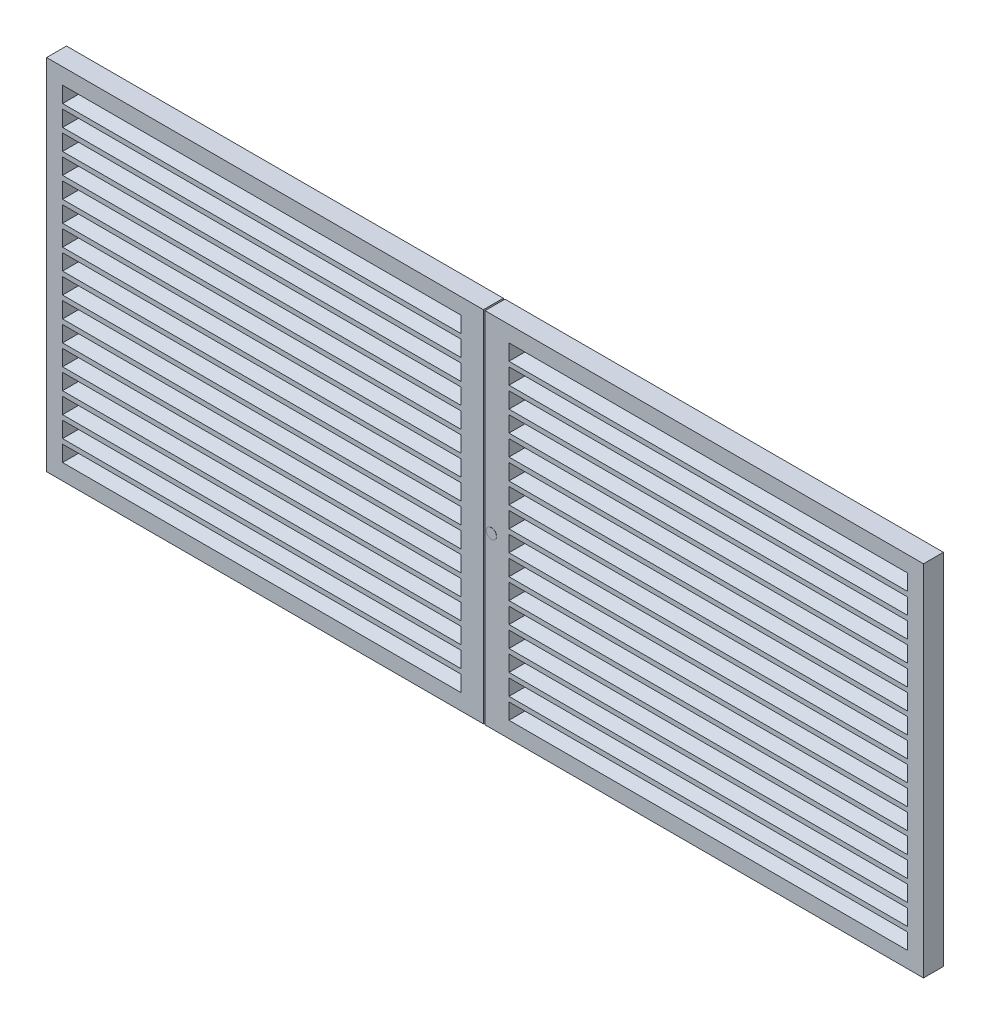
from build123d import *

# Parameters (mm, degrees)
CROQUIS1_W                      = 11000
CROQUIS1_H                      = 4500
SALIENTE_EXTRUIR1_DEPTH         = 250
CROQUIS2_W                      = 5000
CROQUIS2_H                      = 200
CORTAR_EXTRUIR1_DEPTH           = 250
CORTAR_EXTRUIR1_DRAFT           = -20
CORTAR_EXTRUIR1_PROFILE_2_DEPTH = 250
CORTAR_EXTRUIR1_PROFILE_2_DRAFT = -20
MATRIZL1_COPY_1_SKETCH_W        = 5000
MATRIZL1_COPY_1_SKETCH_H        = 200
MATRIZL1_COPY_1_DEPTH           = 250
MATRIZL1_COPY_1_DRAFT           = -20
MATRIZL1_COPY_2_SKETCH_W        = 5000
MATRIZL1_COPY_2_SKETCH_H        = 200
MATRIZL1_COPY_2_DEPTH           = 250
MATRIZL1_COPY_2_DRAFT           = -20
MATRIZL1_COPY_3_SKETCH_W        = 5000
MATRIZL1_COPY_3_SKETCH_H        = 200
MATRIZL1_COPY_3_DEPTH           = 250
MATRIZL1_COPY_3_DRAFT           = -20
MATRIZL1_COPY_4_SKETCH_W        = 5000
MATRIZL1_COPY_4_SKETCH_H        = 200
MATRIZL1_COPY_4_DEPTH           = 250
MATRIZL1_COPY_4_DRAFT           = -20
MATRIZL1_COPY_5_SKETCH_W        = 5000
MATRIZL1_COPY_5_SKETCH_H        = 200
MATRIZL1_COPY_5_DEPTH           = 250
MATRIZL1_COPY_5_DRAFT           = -20
MATRIZL1_COPY_6_SKETCH_W        = 5000
MATRIZL1_COPY_6_SKETCH_H        = 200
MATRIZL1_COPY_6_DEPTH           = 250
MATRIZL1_COPY_6_DRAFT           = -20
MATRIZL1_COPY_7_SKETCH_W        = 5000
MATRIZL1_COPY_7_SKETCH_H        = 200
MATRIZL1_COPY_7_DEPTH           = 250
MATRIZL1_COPY_7_DRAFT           = -20
MATRIZL1_COPY_8_SKETCH_W        = 5000
MATRIZL1_COPY_8_SKETCH_H        = 200
MATRIZL1_COPY_8_DEPTH           = 250
MATRIZL1_COPY_8_DRAFT           = -20
MATRIZL1_COPY_9_SKETCH_W        = 5000
MATRIZL1_COPY_9_SKETCH_H        = 200
MATRIZL1_COPY_9_DEPTH           = 250
MATRIZL1_COPY_9_DRAFT           = -20
MATRIZL1_COPY_10_SKETCH_W       = 5000
MATRIZL1_COPY_10_SKETCH_H       = 200
MATRIZL1_COPY_10_DEPTH          = 250
MATRIZL1_COPY_10_DRAFT          = -20
MATRIZL1_COPY_11_SKETCH_W       = 5000
MATRIZL1_COPY_11_SKETCH_H       = 200
MATRIZL1_COPY_11_DEPTH          = 250
MATRIZL1_COPY_11_DRAFT          = -20
MATRIZL1_COPY_12_SKETCH_W       = 5000
MATRIZL1_COPY_12_SKETCH_H       = 200
MATRIZL1_COPY_12_DEPTH          = 250
MATRIZL1_COPY_12_DRAFT          = -20
MATRIZL1_COPY_13_SKETCH_W       = 5000
MATRIZL1_COPY_13_SKETCH_H       = 200
MATRIZL1_COPY_13_DEPTH          = 250
MATRIZL1_COPY_13_DRAFT          = -20
MATRIZL1_COPY_14_SKETCH_W       = 5000
MATRIZL1_COPY_14_SKETCH_H       = 200
MATRIZL1_COPY_14_DEPTH          = 250
MATRIZL1_COPY_14_DRAFT          = -20
MATRIZL1_COPY_15_SKETCH_W       = 5000
MATRIZL1_COPY_15_SKETCH_H       = 200
MATRIZL1_COPY_15_DEPTH          = 250
MATRIZL1_COPY_15_DRAFT          = -20
MATRIZL1_COPY_16_SKETCH_W       = 5000
MATRIZL1_COPY_16_SKETCH_H       = 200
MATRIZL1_COPY_16_DEPTH          = 250
MATRIZL1_COPY_16_DRAFT          = -20
MATRIZL1_COPY_17_SKETCH_W       = 5000
MATRIZL1_COPY_17_SKETCH_H       = 200
MATRIZL1_COPY_17_DEPTH          = 250
MATRIZL1_COPY_17_DRAFT          = -20
MATRIZL1_COPY_18_SKETCH_W       = 5000
MATRIZL1_COPY_18_SKETCH_H       = 200
MATRIZL1_COPY_18_DEPTH          = 250
MATRIZL1_COPY_18_DRAFT          = -20
MATRIZL1_COPY_19_SKETCH_W       = 5000
MATRIZL1_COPY_19_SKETCH_H       = 200
MATRIZL1_COPY_19_DEPTH          = 250
MATRIZL1_COPY_19_DRAFT          = -20
MATRIZL1_COPY_20_SKETCH_W       = 5000
MATRIZL1_COPY_20_SKETCH_H       = 200
MATRIZL1_COPY_20_DEPTH          = 250
MATRIZL1_COPY_20_DRAFT          = -20
MATRIZL1_COPY_21_SKETCH_W       = 5000
MATRIZL1_COPY_21_SKETCH_H       = 200
MATRIZL1_COPY_21_DEPTH          = 250
MATRIZL1_COPY_21_DRAFT          = -20
MATRIZL1_COPY_22_SKETCH_W       = 5000
MATRIZL1_COPY_22_SKETCH_H       = 200
MATRIZL1_COPY_22_DEPTH          = 250
MATRIZL1_COPY_22_DRAFT          = -20
MATRIZL1_COPY_23_SKETCH_W       = 5000
MATRIZL1_COPY_23_SKETCH_H       = 200
MATRIZL1_COPY_23_DEPTH          = 250
MATRIZL1_COPY_23_DRAFT          = -20
MATRIZL1_COPY_24_SKETCH_W       = 5000
MATRIZL1_COPY_24_SKETCH_H       = 200
MATRIZL1_COPY_24_DEPTH          = 250
MATRIZL1_COPY_24_DRAFT          = -20
MATRIZL1_COPY_25_SKETCH_W       = 5000
MATRIZL1_COPY_25_SKETCH_H       = 200
MATRIZL1_COPY_25_DEPTH          = 250
MATRIZL1_COPY_25_DRAFT          = -20
MATRIZL1_COPY_26_SKETCH_W       = 5000
MATRIZL1_COPY_26_SKETCH_H       = 200
MATRIZL1_COPY_26_DEPTH          = 250
MATRIZL1_COPY_26_DRAFT          = -20
MATRIZL1_COPY_27_SKETCH_W       = 5000
MATRIZL1_COPY_27_SKETCH_H       = 200
MATRIZL1_COPY_27_DEPTH          = 250
MATRIZL1_COPY_27_DRAFT          = -20
MATRIZL1_COPY_28_SKETCH_W       = 5000
MATRIZL1_COPY_28_SKETCH_H       = 200
MATRIZL1_COPY_28_DEPTH          = 250
MATRIZL1_COPY_28_DRAFT          = -20
MATRIZL1_COPY_29_SKETCH_W       = 5000
MATRIZL1_COPY_29_SKETCH_H       = 200
MATRIZL1_COPY_29_DEPTH          = 250
MATRIZL1_COPY_29_DRAFT          = -20
MATRIZL1_COPY_30_SKETCH_W       = 5000
MATRIZL1_COPY_30_SKETCH_H       = 200
MATRIZL1_COPY_30_DEPTH          = 250
MATRIZL1_COPY_30_DRAFT          = -20
MATRIZL1_COPY_31_SKETCH_W       = 5000
MATRIZL1_COPY_31_SKETCH_H       = 200
MATRIZL1_COPY_31_DEPTH          = 250
MATRIZL1_COPY_31_DRAFT          = -20
MATRIZL1_COPY_32_SKETCH_W       = 5000
MATRIZL1_COPY_32_SKETCH_H       = 200
MATRIZL1_COPY_32_DEPTH          = 250
MATRIZL1_COPY_32_DRAFT          = -20
MATRIZL1_COPY_33_SKETCH_W       = 5000
MATRIZL1_COPY_33_SKETCH_H       = 200
MATRIZL1_COPY_33_DEPTH          = 250
MATRIZL1_COPY_33_DRAFT          = -20
MATRIZL1_COPY_34_SKETCH_W       = 5000
MATRIZL1_COPY_34_SKETCH_H       = 200
MATRIZL1_COPY_34_DEPTH          = 250
MATRIZL1_COPY_34_DRAFT          = -20
MATRIZL1_COPY_35_SKETCH_W       = 5000
MATRIZL1_COPY_35_SKETCH_H       = 200
MATRIZL1_COPY_35_DEPTH          = 250
MATRIZL1_COPY_35_DRAFT          = -20
MATRIZL1_COPY_36_SKETCH_W       = 5000
MATRIZL1_COPY_36_SKETCH_H       = 200
MATRIZL1_COPY_36_DEPTH          = 250
MATRIZL1_COPY_36_DRAFT          = -20
MATRIZL1_COPY_37_SKETCH_W       = 5000
MATRIZL1_COPY_37_SKETCH_H       = 200
MATRIZL1_COPY_37_DEPTH          = 250
MATRIZL1_COPY_37_DRAFT          = -20
MATRIZL1_COPY_38_SKETCH_W       = 5000
MATRIZL1_COPY_38_SKETCH_H       = 200
MATRIZL1_COPY_38_DEPTH          = 250
MATRIZL1_COPY_38_DRAFT          = -20
MATRIZL1_COPY_39_SKETCH_W       = 5000
MATRIZL1_COPY_39_SKETCH_H       = 200
MATRIZL1_COPY_39_DEPTH          = 250
MATRIZL1_COPY_39_DRAFT          = -20
MATRIZL1_COPY_40_SKETCH_W       = 5000
MATRIZL1_COPY_40_SKETCH_H       = 200
MATRIZL1_COPY_40_DEPTH          = 250
MATRIZL1_COPY_40_DRAFT          = -20
MATRIZL1_COPY_41_SKETCH_W       = 5000
MATRIZL1_COPY_41_SKETCH_H       = 200
MATRIZL1_COPY_41_DEPTH          = 250
MATRIZL1_COPY_41_DRAFT          = -20
MATRIZL1_COPY_42_SKETCH_W       = 5000
MATRIZL1_COPY_42_SKETCH_H       = 200
MATRIZL1_COPY_42_DEPTH          = 250
MATRIZL1_COPY_42_DRAFT          = -20
MATRIZL1_COPY_43_SKETCH_W       = 5000
MATRIZL1_COPY_43_SKETCH_H       = 200
MATRIZL1_COPY_43_DEPTH          = 250
MATRIZL1_COPY_43_DRAFT          = -20
MATRIZL1_COPY_44_SKETCH_W       = 5000
MATRIZL1_COPY_44_SKETCH_H       = 200
MATRIZL1_COPY_44_DEPTH          = 250
MATRIZL1_COPY_44_DRAFT          = -20
MATRIZL1_COPY_45_SKETCH_W       = 5000
MATRIZL1_COPY_45_SKETCH_H       = 200
MATRIZL1_COPY_45_DEPTH          = 250
MATRIZL1_COPY_45_DRAFT          = -20
CROQUIS3_R                      = 64.149560556
SALIENTE_EXTRUIR2_DEPTH         = 2
CROQUIS4_W                      = 20.5083018
CROQUIS4_H                      = 4500
CORTAR_EXTRUIR2_DEPTH           = 250


with BuildPart() as part:
    # Croquis1 → Saliente-Extruir1 (new body)
    with BuildSketch(Plane.XY):
        with Locations((5500, 2250)):
            Rectangle(CROQUIS1_W, CROQUIS1_H)
    extrude(amount=SALIENTE_EXTRUIR1_DEPTH)


with BuildPart() as cortar_extruir1_tool:
    # Croquis2 → Cortar-Extruir1 (with draft: the straight prism first)
    with BuildSketch(Plane.XY.offset(250)):
        with Locations((2700, 4200)):
            Rectangle(CROQUIS2_W, CROQUIS2_H)
    extrude(amount=-CORTAR_EXTRUIR1_DEPTH)
    # Cortar-Extruir1: the draft: its side faces are tilted about the plane it starts from
    cortar_extruir1_sides = [cortar_extruir1_tool.faces().sort_by_distance(p)[0] for p in [
        (200, 4200, 125),
        (2700, 4100, 125),
        (5200, 4200, 125),
        (2700, 4300, 125),
    ]]
    draft(cortar_extruir1_sides, Plane.XY.offset(250), CORTAR_EXTRUIR1_DRAFT)


with BuildPart() as part_1:
    add(part.part)

    # Cortar-Extruir1: cut by cortar_extruir1_tool
    add(cortar_extruir1_tool.part, mode=Mode.SUBTRACT)


with BuildPart() as cortar_extruir1_profile_2_tool:
    # Croquis2 → Cortar-Extruir1 profile 2 (with draft: the straight prism first)
    with BuildSketch(Plane.XY.offset(250)):
        with Locations((8300, 4200)):
            Rectangle(CROQUIS2_W, CROQUIS2_H)
    extrude(amount=-CORTAR_EXTRUIR1_PROFILE_2_DEPTH)
    # Cortar-Extruir1 profile 2: the draft: its side faces are tilted about the plane it starts from
    cortar_extruir1_profile_2_sides = [cortar_extruir1_profile_2_tool.faces().sort_by_distance(p)[0] for p in [
        (8300, 4300, 125),
        (5800, 4200, 125),
        (8300, 4100, 125),
        (10800, 4200, 125),
    ]]
    draft(cortar_extruir1_profile_2_sides, Plane.XY.offset(250), CORTAR_EXTRUIR1_PROFILE_2_DRAFT)


with BuildPart() as part_2:
    add(part_1.part)

    # Cortar-Extruir1 profile 2: cut by cortar_extruir1_profile_2_tool
    add(cortar_extruir1_profile_2_tool.part, mode=Mode.SUBTRACT)


with BuildPart() as matrizl1_copy_1_tool:
    # MatrizL1 copy 1 sketch → MatrizL1 copy 1 (with draft: the straight prism first)
    with BuildSketch(Plane(origin=(0, -260, 250), x_dir=(1, 0, 0), z_dir=(0, 0, 1))):
        with Locations((2700, 4200)):
            Rectangle(MATRIZL1_COPY_1_SKETCH_W, MATRIZL1_COPY_1_SKETCH_H)
    extrude(amount=-MATRIZL1_COPY_1_DEPTH)
    # MatrizL1 copy 1: the draft: its side faces are tilted about the plane it starts from
    matrizl1_copy_1_sides = [matrizl1_copy_1_tool.faces().sort_by_distance(p)[0] for p in [
        (200, 3940, 125),
        (2700, 3840, 125),
        (5200, 3940, 125),
        (2700, 4040, 125),
    ]]
    draft(matrizl1_copy_1_sides, Plane(origin=(0, -260, 250), x_dir=(1, 0, 0), z_dir=(0, 0, 1)), MATRIZL1_COPY_1_DRAFT)


with BuildPart() as part_3:
    add(part_2.part)

    # MatrizL1 copy 1: cut by matrizl1_copy_1_tool
    add(matrizl1_copy_1_tool.part, mode=Mode.SUBTRACT)


with BuildPart() as matrizl1_copy_2_tool:
    # MatrizL1 copy 2 sketch → MatrizL1 copy 2 (with draft: the straight prism first)
    with BuildSketch(Plane(origin=(0, -520, 250), x_dir=(1, 0, 0), z_dir=(0, 0, 1))):
        with Locations((2700, 4200)):
            Rectangle(MATRIZL1_COPY_2_SKETCH_W, MATRIZL1_COPY_2_SKETCH_H)
    extrude(amount=-MATRIZL1_COPY_2_DEPTH)
    # MatrizL1 copy 2: the draft: its side faces are tilted about the plane it starts from
    matrizl1_copy_2_sides = [matrizl1_copy_2_tool.faces().sort_by_distance(p)[0] for p in [
        (200, 3680, 125),
        (2700, 3580, 125),
        (5200, 3680, 125),
        (2700, 3780, 125),
    ]]
    draft(matrizl1_copy_2_sides, Plane(origin=(0, -520, 250), x_dir=(1, 0, 0), z_dir=(0, 0, 1)), MATRIZL1_COPY_2_DRAFT)


with BuildPart() as part_4:
    add(part_3.part)

    # MatrizL1 copy 2: cut by matrizl1_copy_2_tool
    add(matrizl1_copy_2_tool.part, mode=Mode.SUBTRACT)


with BuildPart() as matrizl1_copy_3_tool:
    # MatrizL1 copy 3 sketch → MatrizL1 copy 3 (with draft: the straight prism first)
    with BuildSketch(Plane(origin=(0, -780, 250), x_dir=(1, 0, 0), z_dir=(0, 0, 1))):
        with Locations((2700, 4200)):
            Rectangle(MATRIZL1_COPY_3_SKETCH_W, MATRIZL1_COPY_3_SKETCH_H)
    extrude(amount=-MATRIZL1_COPY_3_DEPTH)
    # MatrizL1 copy 3: the draft: its side faces are tilted about the plane it starts from
    matrizl1_copy_3_sides = [matrizl1_copy_3_tool.faces().sort_by_distance(p)[0] for p in [
        (200, 3420, 125),
        (2700, 3320, 125),
        (5200, 3420, 125),
        (2700, 3520, 125),
    ]]
    draft(matrizl1_copy_3_sides, Plane(origin=(0, -780, 250), x_dir=(1, 0, 0), z_dir=(0, 0, 1)), MATRIZL1_COPY_3_DRAFT)


with BuildPart() as part_5:
    add(part_4.part)

    # MatrizL1 copy 3: cut by matrizl1_copy_3_tool
    add(matrizl1_copy_3_tool.part, mode=Mode.SUBTRACT)


with BuildPart() as matrizl1_copy_4_tool:
    # MatrizL1 copy 4 sketch → MatrizL1 copy 4 (with draft: the straight prism first)
    with BuildSketch(Plane(origin=(0, -1040, 250), x_dir=(1, 0, 0), z_dir=(0, 0, 1))):
        with Locations((2700, 4200)):
            Rectangle(MATRIZL1_COPY_4_SKETCH_W, MATRIZL1_COPY_4_SKETCH_H)
    extrude(amount=-MATRIZL1_COPY_4_DEPTH)
    # MatrizL1 copy 4: the draft: its side faces are tilted about the plane it starts from
    matrizl1_copy_4_sides = [matrizl1_copy_4_tool.faces().sort_by_distance(p)[0] for p in [
        (200, 3160, 125),
        (2700, 3060, 125),
        (5200, 3160, 125),
        (2700, 3260, 125),
    ]]
    draft(matrizl1_copy_4_sides, Plane(origin=(0, -1040, 250), x_dir=(1, 0, 0), z_dir=(0, 0, 1)), MATRIZL1_COPY_4_DRAFT)


with BuildPart() as part_6:
    add(part_5.part)

    # MatrizL1 copy 4: cut by matrizl1_copy_4_tool
    add(matrizl1_copy_4_tool.part, mode=Mode.SUBTRACT)


with BuildPart() as matrizl1_copy_5_tool:
    # MatrizL1 copy 5 sketch → MatrizL1 copy 5 (with draft: the straight prism first)
    with BuildSketch(Plane(origin=(0, -1300, 250), x_dir=(1, 0, 0), z_dir=(0, 0, 1))):
        with Locations((2700, 4200)):
            Rectangle(MATRIZL1_COPY_5_SKETCH_W, MATRIZL1_COPY_5_SKETCH_H)
    extrude(amount=-MATRIZL1_COPY_5_DEPTH)
    # MatrizL1 copy 5: the draft: its side faces are tilted about the plane it starts from
    matrizl1_copy_5_sides = [matrizl1_copy_5_tool.faces().sort_by_distance(p)[0] for p in [
        (200, 2900, 125),
        (2700, 2800, 125),
        (5200, 2900, 125),
        (2700, 3000, 125),
    ]]
    draft(matrizl1_copy_5_sides, Plane(origin=(0, -1300, 250), x_dir=(1, 0, 0), z_dir=(0, 0, 1)), MATRIZL1_COPY_5_DRAFT)


with BuildPart() as part_7:
    add(part_6.part)

    # MatrizL1 copy 5: cut by matrizl1_copy_5_tool
    add(matrizl1_copy_5_tool.part, mode=Mode.SUBTRACT)


with BuildPart() as matrizl1_copy_6_tool:
    # MatrizL1 copy 6 sketch → MatrizL1 copy 6 (with draft: the straight prism first)
    with BuildSketch(Plane(origin=(0, -1560, 250), x_dir=(1, 0, 0), z_dir=(0, 0, 1))):
        with Locations((2700, 4200)):
            Rectangle(MATRIZL1_COPY_6_SKETCH_W, MATRIZL1_COPY_6_SKETCH_H)
    extrude(amount=-MATRIZL1_COPY_6_DEPTH)
    # MatrizL1 copy 6: the draft: its side faces are tilted about the plane it starts from
    matrizl1_copy_6_sides = [matrizl1_copy_6_tool.faces().sort_by_distance(p)[0] for p in [
        (200, 2640, 125),
        (2700, 2540, 125),
        (5200, 2640, 125),
        (2700, 2740, 125),
    ]]
    draft(matrizl1_copy_6_sides, Plane(origin=(0, -1560, 250), x_dir=(1, 0, 0), z_dir=(0, 0, 1)), MATRIZL1_COPY_6_DRAFT)


with BuildPart() as part_8:
    add(part_7.part)

    # MatrizL1 copy 6: cut by matrizl1_copy_6_tool
    add(matrizl1_copy_6_tool.part, mode=Mode.SUBTRACT)


with BuildPart() as matrizl1_copy_7_tool:
    # MatrizL1 copy 7 sketch → MatrizL1 copy 7 (with draft: the straight prism first)
    with BuildSketch(Plane(origin=(0, -1820, 250), x_dir=(1, 0, 0), z_dir=(0, 0, 1))):
        with Locations((2700, 4200)):
            Rectangle(MATRIZL1_COPY_7_SKETCH_W, MATRIZL1_COPY_7_SKETCH_H)
    extrude(amount=-MATRIZL1_COPY_7_DEPTH)
    # MatrizL1 copy 7: the draft: its side faces are tilted about the plane it starts from
    matrizl1_copy_7_sides = [matrizl1_copy_7_tool.faces().sort_by_distance(p)[0] for p in [
        (200, 2380, 125),
        (2700, 2280, 125),
        (5200, 2380, 125),
        (2700, 2480, 125),
    ]]
    draft(matrizl1_copy_7_sides, Plane(origin=(0, -1820, 250), x_dir=(1, 0, 0), z_dir=(0, 0, 1)), MATRIZL1_COPY_7_DRAFT)


with BuildPart() as part_9:
    add(part_8.part)

    # MatrizL1 copy 7: cut by matrizl1_copy_7_tool
    add(matrizl1_copy_7_tool.part, mode=Mode.SUBTRACT)


with BuildPart() as matrizl1_copy_8_tool:
    # MatrizL1 copy 8 sketch → MatrizL1 copy 8 (with draft: the straight prism first)
    with BuildSketch(Plane(origin=(0, -2080, 250), x_dir=(1, 0, 0), z_dir=(0, 0, 1))):
        with Locations((2700, 4200)):
            Rectangle(MATRIZL1_COPY_8_SKETCH_W, MATRIZL1_COPY_8_SKETCH_H)
    extrude(amount=-MATRIZL1_COPY_8_DEPTH)
    # MatrizL1 copy 8: the draft: its side faces are tilted about the plane it starts from
    matrizl1_copy_8_sides = [matrizl1_copy_8_tool.faces().sort_by_distance(p)[0] for p in [
        (200, 2120, 125),
        (2700, 2020, 125),
        (5200, 2120, 125),
        (2700, 2220, 125),
    ]]
    draft(matrizl1_copy_8_sides, Plane(origin=(0, -2080, 250), x_dir=(1, 0, 0), z_dir=(0, 0, 1)), MATRIZL1_COPY_8_DRAFT)


with BuildPart() as part_10:
    add(part_9.part)

    # MatrizL1 copy 8: cut by matrizl1_copy_8_tool
    add(matrizl1_copy_8_tool.part, mode=Mode.SUBTRACT)


with BuildPart() as matrizl1_copy_9_tool:
    # MatrizL1 copy 9 sketch → MatrizL1 copy 9 (with draft: the straight prism first)
    with BuildSketch(Plane(origin=(0, -2340, 250), x_dir=(1, 0, 0), z_dir=(0, 0, 1))):
        with Locations((2700, 4200)):
            Rectangle(MATRIZL1_COPY_9_SKETCH_W, MATRIZL1_COPY_9_SKETCH_H)
    extrude(amount=-MATRIZL1_COPY_9_DEPTH)
    # MatrizL1 copy 9: the draft: its side faces are tilted about the plane it starts from
    matrizl1_copy_9_sides = [matrizl1_copy_9_tool.faces().sort_by_distance(p)[0] for p in [
        (200, 1860, 125),
        (2700, 1760, 125),
        (5200, 1860, 125),
        (2700, 1960, 125),
    ]]
    draft(matrizl1_copy_9_sides, Plane(origin=(0, -2340, 250), x_dir=(1, 0, 0), z_dir=(0, 0, 1)), MATRIZL1_COPY_9_DRAFT)


with BuildPart() as part_11:
    add(part_10.part)

    # MatrizL1 copy 9: cut by matrizl1_copy_9_tool
    add(matrizl1_copy_9_tool.part, mode=Mode.SUBTRACT)


with BuildPart() as matrizl1_copy_10_tool:
    # MatrizL1 copy 10 sketch → MatrizL1 copy 10 (with draft: the straight prism first)
    with BuildSketch(Plane(origin=(0, -2600, 250), x_dir=(1, 0, 0), z_dir=(0, 0, 1))):
        with Locations((2700, 4200)):
            Rectangle(MATRIZL1_COPY_10_SKETCH_W, MATRIZL1_COPY_10_SKETCH_H)
    extrude(amount=-MATRIZL1_COPY_10_DEPTH)
    # MatrizL1 copy 10: the draft: its side faces are tilted about the plane it starts from
    matrizl1_copy_10_sides = [matrizl1_copy_10_tool.faces().sort_by_distance(p)[0] for p in [
        (200, 1600, 125),
        (2700, 1500, 125),
        (5200, 1600, 125),
        (2700, 1700, 125),
    ]]
    draft(matrizl1_copy_10_sides, Plane(origin=(0, -2600, 250), x_dir=(1, 0, 0), z_dir=(0, 0, 1)), MATRIZL1_COPY_10_DRAFT)


with BuildPart() as part_12:
    add(part_11.part)

    # MatrizL1 copy 10: cut by matrizl1_copy_10_tool
    add(matrizl1_copy_10_tool.part, mode=Mode.SUBTRACT)


with BuildPart() as matrizl1_copy_11_tool:
    # MatrizL1 copy 11 sketch → MatrizL1 copy 11 (with draft: the straight prism first)
    with BuildSketch(Plane(origin=(0, -2860, 250), x_dir=(1, 0, 0), z_dir=(0, 0, 1))):
        with Locations((2700, 4200)):
            Rectangle(MATRIZL1_COPY_11_SKETCH_W, MATRIZL1_COPY_11_SKETCH_H)
    extrude(amount=-MATRIZL1_COPY_11_DEPTH)
    # MatrizL1 copy 11: the draft: its side faces are tilted about the plane it starts from
    matrizl1_copy_11_sides = [matrizl1_copy_11_tool.faces().sort_by_distance(p)[0] for p in [
        (200, 1340, 125),
        (2700, 1240, 125),
        (5200, 1340, 125),
        (2700, 1440, 125),
    ]]
    draft(matrizl1_copy_11_sides, Plane(origin=(0, -2860, 250), x_dir=(1, 0, 0), z_dir=(0, 0, 1)), MATRIZL1_COPY_11_DRAFT)


with BuildPart() as part_13:
    add(part_12.part)

    # MatrizL1 copy 11: cut by matrizl1_copy_11_tool
    add(matrizl1_copy_11_tool.part, mode=Mode.SUBTRACT)


with BuildPart() as matrizl1_copy_12_tool:
    # MatrizL1 copy 12 sketch → MatrizL1 copy 12 (with draft: the straight prism first)
    with BuildSketch(Plane(origin=(0, -3120, 250), x_dir=(1, 0, 0), z_dir=(0, 0, 1))):
        with Locations((2700, 4200)):
            Rectangle(MATRIZL1_COPY_12_SKETCH_W, MATRIZL1_COPY_12_SKETCH_H)
    extrude(amount=-MATRIZL1_COPY_12_DEPTH)
    # MatrizL1 copy 12: the draft: its side faces are tilted about the plane it starts from
    matrizl1_copy_12_sides = [matrizl1_copy_12_tool.faces().sort_by_distance(p)[0] for p in [
        (200, 1080, 125),
        (2700, 980, 125),
        (5200, 1080, 125),
        (2700, 1180, 125),
    ]]
    draft(matrizl1_copy_12_sides, Plane(origin=(0, -3120, 250), x_dir=(1, 0, 0), z_dir=(0, 0, 1)), MATRIZL1_COPY_12_DRAFT)


with BuildPart() as part_14:
    add(part_13.part)

    # MatrizL1 copy 12: cut by matrizl1_copy_12_tool
    add(matrizl1_copy_12_tool.part, mode=Mode.SUBTRACT)


with BuildPart() as matrizl1_copy_13_tool:
    # MatrizL1 copy 13 sketch → MatrizL1 copy 13 (with draft: the straight prism first)
    with BuildSketch(Plane(origin=(0, -3380, 250), x_dir=(1, 0, 0), z_dir=(0, 0, 1))):
        with Locations((2700, 4200)):
            Rectangle(MATRIZL1_COPY_13_SKETCH_W, MATRIZL1_COPY_13_SKETCH_H)
    extrude(amount=-MATRIZL1_COPY_13_DEPTH)
    # MatrizL1 copy 13: the draft: its side faces are tilted about the plane it starts from
    matrizl1_copy_13_sides = [matrizl1_copy_13_tool.faces().sort_by_distance(p)[0] for p in [
        (200, 820, 125),
        (2700, 720, 125),
        (5200, 820, 125),
        (2700, 920, 125),
    ]]
    draft(matrizl1_copy_13_sides, Plane(origin=(0, -3380, 250), x_dir=(1, 0, 0), z_dir=(0, 0, 1)), MATRIZL1_COPY_13_DRAFT)


with BuildPart() as part_15:
    add(part_14.part)

    # MatrizL1 copy 13: cut by matrizl1_copy_13_tool
    add(matrizl1_copy_13_tool.part, mode=Mode.SUBTRACT)


with BuildPart() as matrizl1_copy_14_tool:
    # MatrizL1 copy 14 sketch → MatrizL1 copy 14 (with draft: the straight prism first)
    with BuildSketch(Plane(origin=(0, -3640, 250), x_dir=(1, 0, 0), z_dir=(0, 0, 1))):
        with Locations((2700, 4200)):
            Rectangle(MATRIZL1_COPY_14_SKETCH_W, MATRIZL1_COPY_14_SKETCH_H)
    extrude(amount=-MATRIZL1_COPY_14_DEPTH)
    # MatrizL1 copy 14: the draft: its side faces are tilted about the plane it starts from
    matrizl1_copy_14_sides = [matrizl1_copy_14_tool.faces().sort_by_distance(p)[0] for p in [
        (200, 560, 125),
        (2700, 460, 125),
        (5200, 560, 125),
        (2700, 660, 125),
    ]]
    draft(matrizl1_copy_14_sides, Plane(origin=(0, -3640, 250), x_dir=(1, 0, 0), z_dir=(0, 0, 1)), MATRIZL1_COPY_14_DRAFT)


with BuildPart() as part_16:
    add(part_15.part)

    # MatrizL1 copy 14: cut by matrizl1_copy_14_tool
    add(matrizl1_copy_14_tool.part, mode=Mode.SUBTRACT)


with BuildPart() as matrizl1_copy_15_tool:
    # MatrizL1 copy 15 sketch → MatrizL1 copy 15 (with draft: the straight prism first)
    with BuildSketch(Plane(origin=(0, -3900, 250), x_dir=(1, 0, 0), z_dir=(0, 0, 1))):
        with Locations((2700, 4200)):
            Rectangle(MATRIZL1_COPY_15_SKETCH_W, MATRIZL1_COPY_15_SKETCH_H)
    extrude(amount=-MATRIZL1_COPY_15_DEPTH)
    # MatrizL1 copy 15: the draft: its side faces are tilted about the plane it starts from
    matrizl1_copy_15_sides = [matrizl1_copy_15_tool.faces().sort_by_distance(p)[0] for p in [
        (200, 300, 125),
        (2700, 200, 125),
        (5200, 300, 125),
        (2700, 400, 125),
    ]]
    draft(matrizl1_copy_15_sides, Plane(origin=(0, -3900, 250), x_dir=(1, 0, 0), z_dir=(0, 0, 1)), MATRIZL1_COPY_15_DRAFT)


with BuildPart() as part_17:
    add(part_16.part)

    # MatrizL1 copy 15: cut by matrizl1_copy_15_tool
    add(matrizl1_copy_15_tool.part, mode=Mode.SUBTRACT)


with BuildPart() as matrizl1_copy_16_tool:
    # MatrizL1 copy 16 sketch → MatrizL1 copy 16 (with draft: the straight prism first)
    with BuildSketch(Plane(origin=(0, -260, 250), x_dir=(1, 0, 0), z_dir=(0, 0, 1))):
        with Locations((8300, 4200)):
            Rectangle(MATRIZL1_COPY_16_SKETCH_W, MATRIZL1_COPY_16_SKETCH_H)
    extrude(amount=-MATRIZL1_COPY_16_DEPTH)
    # MatrizL1 copy 16: the draft: its side faces are tilted about the plane it starts from
    matrizl1_copy_16_sides = [matrizl1_copy_16_tool.faces().sort_by_distance(p)[0] for p in [
        (8300, 4040, 125),
        (5800, 3940, 125),
        (8300, 3840, 125),
        (10800, 3940, 125),
    ]]
    draft(matrizl1_copy_16_sides, Plane(origin=(0, -260, 250), x_dir=(1, 0, 0), z_dir=(0, 0, 1)), MATRIZL1_COPY_16_DRAFT)


with BuildPart() as part_18:
    add(part_17.part)

    # MatrizL1 copy 16: cut by matrizl1_copy_16_tool
    add(matrizl1_copy_16_tool.part, mode=Mode.SUBTRACT)


with BuildPart() as matrizl1_copy_17_tool:
    # MatrizL1 copy 17 sketch → MatrizL1 copy 17 (with draft: the straight prism first)
    with BuildSketch(Plane(origin=(0, -520, 250), x_dir=(1, 0, 0), z_dir=(0, 0, 1))):
        with Locations((8300, 4200)):
            Rectangle(MATRIZL1_COPY_17_SKETCH_W, MATRIZL1_COPY_17_SKETCH_H)
    extrude(amount=-MATRIZL1_COPY_17_DEPTH)
    # MatrizL1 copy 17: the draft: its side faces are tilted about the plane it starts from
    matrizl1_copy_17_sides = [matrizl1_copy_17_tool.faces().sort_by_distance(p)[0] for p in [
        (8300, 3780, 125),
        (5800, 3680, 125),
        (8300, 3580, 125),
        (10800, 3680, 125),
    ]]
    draft(matrizl1_copy_17_sides, Plane(origin=(0, -520, 250), x_dir=(1, 0, 0), z_dir=(0, 0, 1)), MATRIZL1_COPY_17_DRAFT)


with BuildPart() as part_19:
    add(part_18.part)

    # MatrizL1 copy 17: cut by matrizl1_copy_17_tool
    add(matrizl1_copy_17_tool.part, mode=Mode.SUBTRACT)


with BuildPart() as matrizl1_copy_18_tool:
    # MatrizL1 copy 18 sketch → MatrizL1 copy 18 (with draft: the straight prism first)
    with BuildSketch(Plane(origin=(0, -780, 250), x_dir=(1, 0, 0), z_dir=(0, 0, 1))):
        with Locations((8300, 4200)):
            Rectangle(MATRIZL1_COPY_18_SKETCH_W, MATRIZL1_COPY_18_SKETCH_H)
    extrude(amount=-MATRIZL1_COPY_18_DEPTH)
    # MatrizL1 copy 18: the draft: its side faces are tilted about the plane it starts from
    matrizl1_copy_18_sides = [matrizl1_copy_18_tool.faces().sort_by_distance(p)[0] for p in [
        (8300, 3520, 125),
        (5800, 3420, 125),
        (8300, 3320, 125),
        (10800, 3420, 125),
    ]]
    draft(matrizl1_copy_18_sides, Plane(origin=(0, -780, 250), x_dir=(1, 0, 0), z_dir=(0, 0, 1)), MATRIZL1_COPY_18_DRAFT)


with BuildPart() as part_20:
    add(part_19.part)

    # MatrizL1 copy 18: cut by matrizl1_copy_18_tool
    add(matrizl1_copy_18_tool.part, mode=Mode.SUBTRACT)


with BuildPart() as matrizl1_copy_19_tool:
    # MatrizL1 copy 19 sketch → MatrizL1 copy 19 (with draft: the straight prism first)
    with BuildSketch(Plane(origin=(0, -1040, 250), x_dir=(1, 0, 0), z_dir=(0, 0, 1))):
        with Locations((8300, 4200)):
            Rectangle(MATRIZL1_COPY_19_SKETCH_W, MATRIZL1_COPY_19_SKETCH_H)
    extrude(amount=-MATRIZL1_COPY_19_DEPTH)
    # MatrizL1 copy 19: the draft: its side faces are tilted about the plane it starts from
    matrizl1_copy_19_sides = [matrizl1_copy_19_tool.faces().sort_by_distance(p)[0] for p in [
        (8300, 3260, 125),
        (5800, 3160, 125),
        (8300, 3060, 125),
        (10800, 3160, 125),
    ]]
    draft(matrizl1_copy_19_sides, Plane(origin=(0, -1040, 250), x_dir=(1, 0, 0), z_dir=(0, 0, 1)), MATRIZL1_COPY_19_DRAFT)


with BuildPart() as part_21:
    add(part_20.part)

    # MatrizL1 copy 19: cut by matrizl1_copy_19_tool
    add(matrizl1_copy_19_tool.part, mode=Mode.SUBTRACT)


with BuildPart() as matrizl1_copy_20_tool:
    # MatrizL1 copy 20 sketch → MatrizL1 copy 20 (with draft: the straight prism first)
    with BuildSketch(Plane(origin=(0, -1300, 250), x_dir=(1, 0, 0), z_dir=(0, 0, 1))):
        with Locations((8300, 4200)):
            Rectangle(MATRIZL1_COPY_20_SKETCH_W, MATRIZL1_COPY_20_SKETCH_H)
    extrude(amount=-MATRIZL1_COPY_20_DEPTH)
    # MatrizL1 copy 20: the draft: its side faces are tilted about the plane it starts from
    matrizl1_copy_20_sides = [matrizl1_copy_20_tool.faces().sort_by_distance(p)[0] for p in [
        (8300, 3000, 125),
        (5800, 2900, 125),
        (8300, 2800, 125),
        (10800, 2900, 125),
    ]]
    draft(matrizl1_copy_20_sides, Plane(origin=(0, -1300, 250), x_dir=(1, 0, 0), z_dir=(0, 0, 1)), MATRIZL1_COPY_20_DRAFT)


with BuildPart() as part_22:
    add(part_21.part)

    # MatrizL1 copy 20: cut by matrizl1_copy_20_tool
    add(matrizl1_copy_20_tool.part, mode=Mode.SUBTRACT)


with BuildPart() as matrizl1_copy_21_tool:
    # MatrizL1 copy 21 sketch → MatrizL1 copy 21 (with draft: the straight prism first)
    with BuildSketch(Plane(origin=(0, -1560, 250), x_dir=(1, 0, 0), z_dir=(0, 0, 1))):
        with Locations((8300, 4200)):
            Rectangle(MATRIZL1_COPY_21_SKETCH_W, MATRIZL1_COPY_21_SKETCH_H)
    extrude(amount=-MATRIZL1_COPY_21_DEPTH)
    # MatrizL1 copy 21: the draft: its side faces are tilted about the plane it starts from
    matrizl1_copy_21_sides = [matrizl1_copy_21_tool.faces().sort_by_distance(p)[0] for p in [
        (8300, 2740, 125),
        (5800, 2640, 125),
        (8300, 2540, 125),
        (10800, 2640, 125),
    ]]
    draft(matrizl1_copy_21_sides, Plane(origin=(0, -1560, 250), x_dir=(1, 0, 0), z_dir=(0, 0, 1)), MATRIZL1_COPY_21_DRAFT)


with BuildPart() as part_23:
    add(part_22.part)

    # MatrizL1 copy 21: cut by matrizl1_copy_21_tool
    add(matrizl1_copy_21_tool.part, mode=Mode.SUBTRACT)


with BuildPart() as matrizl1_copy_22_tool:
    # MatrizL1 copy 22 sketch → MatrizL1 copy 22 (with draft: the straight prism first)
    with BuildSketch(Plane(origin=(0, -1820, 250), x_dir=(1, 0, 0), z_dir=(0, 0, 1))):
        with Locations((8300, 4200)):
            Rectangle(MATRIZL1_COPY_22_SKETCH_W, MATRIZL1_COPY_22_SKETCH_H)
    extrude(amount=-MATRIZL1_COPY_22_DEPTH)
    # MatrizL1 copy 22: the draft: its side faces are tilted about the plane it starts from
    matrizl1_copy_22_sides = [matrizl1_copy_22_tool.faces().sort_by_distance(p)[0] for p in [
        (8300, 2480, 125),
        (5800, 2380, 125),
        (8300, 2280, 125),
        (10800, 2380, 125),
    ]]
    draft(matrizl1_copy_22_sides, Plane(origin=(0, -1820, 250), x_dir=(1, 0, 0), z_dir=(0, 0, 1)), MATRIZL1_COPY_22_DRAFT)


with BuildPart() as part_24:
    add(part_23.part)

    # MatrizL1 copy 22: cut by matrizl1_copy_22_tool
    add(matrizl1_copy_22_tool.part, mode=Mode.SUBTRACT)


with BuildPart() as matrizl1_copy_23_tool:
    # MatrizL1 copy 23 sketch → MatrizL1 copy 23 (with draft: the straight prism first)
    with BuildSketch(Plane(origin=(0, -2080, 250), x_dir=(1, 0, 0), z_dir=(0, 0, 1))):
        with Locations((8300, 4200)):
            Rectangle(MATRIZL1_COPY_23_SKETCH_W, MATRIZL1_COPY_23_SKETCH_H)
    extrude(amount=-MATRIZL1_COPY_23_DEPTH)
    # MatrizL1 copy 23: the draft: its side faces are tilted about the plane it starts from
    matrizl1_copy_23_sides = [matrizl1_copy_23_tool.faces().sort_by_distance(p)[0] for p in [
        (8300, 2220, 125),
        (5800, 2120, 125),
        (8300, 2020, 125),
        (10800, 2120, 125),
    ]]
    draft(matrizl1_copy_23_sides, Plane(origin=(0, -2080, 250), x_dir=(1, 0, 0), z_dir=(0, 0, 1)), MATRIZL1_COPY_23_DRAFT)


with BuildPart() as part_25:
    add(part_24.part)

    # MatrizL1 copy 23: cut by matrizl1_copy_23_tool
    add(matrizl1_copy_23_tool.part, mode=Mode.SUBTRACT)


with BuildPart() as matrizl1_copy_24_tool:
    # MatrizL1 copy 24 sketch → MatrizL1 copy 24 (with draft: the straight prism first)
    with BuildSketch(Plane(origin=(0, -2340, 250), x_dir=(1, 0, 0), z_dir=(0, 0, 1))):
        with Locations((8300, 4200)):
            Rectangle(MATRIZL1_COPY_24_SKETCH_W, MATRIZL1_COPY_24_SKETCH_H)
    extrude(amount=-MATRIZL1_COPY_24_DEPTH)
    # MatrizL1 copy 24: the draft: its side faces are tilted about the plane it starts from
    matrizl1_copy_24_sides = [matrizl1_copy_24_tool.faces().sort_by_distance(p)[0] for p in [
        (8300, 1960, 125),
        (5800, 1860, 125),
        (8300, 1760, 125),
        (10800, 1860, 125),
    ]]
    draft(matrizl1_copy_24_sides, Plane(origin=(0, -2340, 250), x_dir=(1, 0, 0), z_dir=(0, 0, 1)), MATRIZL1_COPY_24_DRAFT)


with BuildPart() as part_26:
    add(part_25.part)

    # MatrizL1 copy 24: cut by matrizl1_copy_24_tool
    add(matrizl1_copy_24_tool.part, mode=Mode.SUBTRACT)


with BuildPart() as matrizl1_copy_25_tool:
    # MatrizL1 copy 25 sketch → MatrizL1 copy 25 (with draft: the straight prism first)
    with BuildSketch(Plane(origin=(0, -2600, 250), x_dir=(1, 0, 0), z_dir=(0, 0, 1))):
        with Locations((8300, 4200)):
            Rectangle(MATRIZL1_COPY_25_SKETCH_W, MATRIZL1_COPY_25_SKETCH_H)
    extrude(amount=-MATRIZL1_COPY_25_DEPTH)
    # MatrizL1 copy 25: the draft: its side faces are tilted about the plane it starts from
    matrizl1_copy_25_sides = [matrizl1_copy_25_tool.faces().sort_by_distance(p)[0] for p in [
        (8300, 1700, 125),
        (5800, 1600, 125),
        (8300, 1500, 125),
        (10800, 1600, 125),
    ]]
    draft(matrizl1_copy_25_sides, Plane(origin=(0, -2600, 250), x_dir=(1, 0, 0), z_dir=(0, 0, 1)), MATRIZL1_COPY_25_DRAFT)


with BuildPart() as part_27:
    add(part_26.part)

    # MatrizL1 copy 25: cut by matrizl1_copy_25_tool
    add(matrizl1_copy_25_tool.part, mode=Mode.SUBTRACT)


with BuildPart() as matrizl1_copy_26_tool:
    # MatrizL1 copy 26 sketch → MatrizL1 copy 26 (with draft: the straight prism first)
    with BuildSketch(Plane(origin=(0, -2860, 250), x_dir=(1, 0, 0), z_dir=(0, 0, 1))):
        with Locations((8300, 4200)):
            Rectangle(MATRIZL1_COPY_26_SKETCH_W, MATRIZL1_COPY_26_SKETCH_H)
    extrude(amount=-MATRIZL1_COPY_26_DEPTH)
    # MatrizL1 copy 26: the draft: its side faces are tilted about the plane it starts from
    matrizl1_copy_26_sides = [matrizl1_copy_26_tool.faces().sort_by_distance(p)[0] for p in [
        (8300, 1440, 125),
        (5800, 1340, 125),
        (8300, 1240, 125),
        (10800, 1340, 125),
    ]]
    draft(matrizl1_copy_26_sides, Plane(origin=(0, -2860, 250), x_dir=(1, 0, 0), z_dir=(0, 0, 1)), MATRIZL1_COPY_26_DRAFT)


with BuildPart() as part_28:
    add(part_27.part)

    # MatrizL1 copy 26: cut by matrizl1_copy_26_tool
    add(matrizl1_copy_26_tool.part, mode=Mode.SUBTRACT)


with BuildPart() as matrizl1_copy_27_tool:
    # MatrizL1 copy 27 sketch → MatrizL1 copy 27 (with draft: the straight prism first)
    with BuildSketch(Plane(origin=(0, -3120, 250), x_dir=(1, 0, 0), z_dir=(0, 0, 1))):
        with Locations((8300, 4200)):
            Rectangle(MATRIZL1_COPY_27_SKETCH_W, MATRIZL1_COPY_27_SKETCH_H)
    extrude(amount=-MATRIZL1_COPY_27_DEPTH)
    # MatrizL1 copy 27: the draft: its side faces are tilted about the plane it starts from
    matrizl1_copy_27_sides = [matrizl1_copy_27_tool.faces().sort_by_distance(p)[0] for p in [
        (8300, 1180, 125),
        (5800, 1080, 125),
        (8300, 980, 125),
        (10800, 1080, 125),
    ]]
    draft(matrizl1_copy_27_sides, Plane(origin=(0, -3120, 250), x_dir=(1, 0, 0), z_dir=(0, 0, 1)), MATRIZL1_COPY_27_DRAFT)


with BuildPart() as part_29:
    add(part_28.part)

    # MatrizL1 copy 27: cut by matrizl1_copy_27_tool
    add(matrizl1_copy_27_tool.part, mode=Mode.SUBTRACT)


with BuildPart() as matrizl1_copy_28_tool:
    # MatrizL1 copy 28 sketch → MatrizL1 copy 28 (with draft: the straight prism first)
    with BuildSketch(Plane(origin=(0, -3380, 250), x_dir=(1, 0, 0), z_dir=(0, 0, 1))):
        with Locations((8300, 4200)):
            Rectangle(MATRIZL1_COPY_28_SKETCH_W, MATRIZL1_COPY_28_SKETCH_H)
    extrude(amount=-MATRIZL1_COPY_28_DEPTH)
    # MatrizL1 copy 28: the draft: its side faces are tilted about the plane it starts from
    matrizl1_copy_28_sides = [matrizl1_copy_28_tool.faces().sort_by_distance(p)[0] for p in [
        (8300, 920, 125),
        (5800, 820, 125),
        (8300, 720, 125),
        (10800, 820, 125),
    ]]
    draft(matrizl1_copy_28_sides, Plane(origin=(0, -3380, 250), x_dir=(1, 0, 0), z_dir=(0, 0, 1)), MATRIZL1_COPY_28_DRAFT)


with BuildPart() as part_30:
    add(part_29.part)

    # MatrizL1 copy 28: cut by matrizl1_copy_28_tool
    add(matrizl1_copy_28_tool.part, mode=Mode.SUBTRACT)


with BuildPart() as matrizl1_copy_29_tool:
    # MatrizL1 copy 29 sketch → MatrizL1 copy 29 (with draft: the straight prism first)
    with BuildSketch(Plane(origin=(0, -3640, 250), x_dir=(1, 0, 0), z_dir=(0, 0, 1))):
        with Locations((8300, 4200)):
            Rectangle(MATRIZL1_COPY_29_SKETCH_W, MATRIZL1_COPY_29_SKETCH_H)
    extrude(amount=-MATRIZL1_COPY_29_DEPTH)
    # MatrizL1 copy 29: the draft: its side faces are tilted about the plane it starts from
    matrizl1_copy_29_sides = [matrizl1_copy_29_tool.faces().sort_by_distance(p)[0] for p in [
        (8300, 660, 125),
        (5800, 560, 125),
        (8300, 460, 125),
        (10800, 560, 125),
    ]]
    draft(matrizl1_copy_29_sides, Plane(origin=(0, -3640, 250), x_dir=(1, 0, 0), z_dir=(0, 0, 1)), MATRIZL1_COPY_29_DRAFT)


with BuildPart() as part_31:
    add(part_30.part)

    # MatrizL1 copy 29: cut by matrizl1_copy_29_tool
    add(matrizl1_copy_29_tool.part, mode=Mode.SUBTRACT)


with BuildPart() as matrizl1_copy_30_tool:
    # MatrizL1 copy 30 sketch → MatrizL1 copy 30 (with draft: the straight prism first)
    with BuildSketch(Plane(origin=(0, -3900, 250), x_dir=(1, 0, 0), z_dir=(0, 0, 1))):
        with Locations((8300, 4200)):
            Rectangle(MATRIZL1_COPY_30_SKETCH_W, MATRIZL1_COPY_30_SKETCH_H)
    extrude(amount=-MATRIZL1_COPY_30_DEPTH)
    # MatrizL1 copy 30: the draft: its side faces are tilted about the plane it starts from
    matrizl1_copy_30_sides = [matrizl1_copy_30_tool.faces().sort_by_distance(p)[0] for p in [
        (8300, 400, 125),
        (5800, 300, 125),
        (8300, 200, 125),
        (10800, 300, 125),
    ]]
    draft(matrizl1_copy_30_sides, Plane(origin=(0, -3900, 250), x_dir=(1, 0, 0), z_dir=(0, 0, 1)), MATRIZL1_COPY_30_DRAFT)


with BuildPart() as part_32:
    add(part_31.part)

    # MatrizL1 copy 30: cut by matrizl1_copy_30_tool
    add(matrizl1_copy_30_tool.part, mode=Mode.SUBTRACT)


with BuildPart() as matrizl1_copy_31_tool:
    # MatrizL1 copy 31 sketch → MatrizL1 copy 31 (with draft: the straight prism first)
    with BuildSketch(Plane(origin=(0, -260, 250), x_dir=(1, 0, 0), z_dir=(0, 0, 1))):
        with Locations((8300, 4200)):
            Rectangle(MATRIZL1_COPY_31_SKETCH_W, MATRIZL1_COPY_31_SKETCH_H)
    extrude(amount=-MATRIZL1_COPY_31_DEPTH)
    # MatrizL1 copy 31: the draft: its side faces are tilted about the plane it starts from
    matrizl1_copy_31_sides = [matrizl1_copy_31_tool.faces().sort_by_distance(p)[0] for p in [
        (8300, 4040, 125),
        (5800, 3940, 125),
        (8300, 3840, 125),
        (10800, 3940, 125),
    ]]
    draft(matrizl1_copy_31_sides, Plane(origin=(0, -260, 250), x_dir=(1, 0, 0), z_dir=(0, 0, 1)), MATRIZL1_COPY_31_DRAFT)


with BuildPart() as part_33:
    add(part_32.part)

    # MatrizL1 copy 31: cut by matrizl1_copy_31_tool
    add(matrizl1_copy_31_tool.part, mode=Mode.SUBTRACT)


with BuildPart() as matrizl1_copy_32_tool:
    # MatrizL1 copy 32 sketch → MatrizL1 copy 32 (with draft: the straight prism first)
    with BuildSketch(Plane(origin=(0, -520, 250), x_dir=(1, 0, 0), z_dir=(0, 0, 1))):
        with Locations((8300, 4200)):
            Rectangle(MATRIZL1_COPY_32_SKETCH_W, MATRIZL1_COPY_32_SKETCH_H)
    extrude(amount=-MATRIZL1_COPY_32_DEPTH)
    # MatrizL1 copy 32: the draft: its side faces are tilted about the plane it starts from
    matrizl1_copy_32_sides = [matrizl1_copy_32_tool.faces().sort_by_distance(p)[0] for p in [
        (8300, 3780, 125),
        (5800, 3680, 125),
        (8300, 3580, 125),
        (10800, 3680, 125),
    ]]
    draft(matrizl1_copy_32_sides, Plane(origin=(0, -520, 250), x_dir=(1, 0, 0), z_dir=(0, 0, 1)), MATRIZL1_COPY_32_DRAFT)


with BuildPart() as part_34:
    add(part_33.part)

    # MatrizL1 copy 32: cut by matrizl1_copy_32_tool
    add(matrizl1_copy_32_tool.part, mode=Mode.SUBTRACT)


with BuildPart() as matrizl1_copy_33_tool:
    # MatrizL1 copy 33 sketch → MatrizL1 copy 33 (with draft: the straight prism first)
    with BuildSketch(Plane(origin=(0, -780, 250), x_dir=(1, 0, 0), z_dir=(0, 0, 1))):
        with Locations((8300, 4200)):
            Rectangle(MATRIZL1_COPY_33_SKETCH_W, MATRIZL1_COPY_33_SKETCH_H)
    extrude(amount=-MATRIZL1_COPY_33_DEPTH)
    # MatrizL1 copy 33: the draft: its side faces are tilted about the plane it starts from
    matrizl1_copy_33_sides = [matrizl1_copy_33_tool.faces().sort_by_distance(p)[0] for p in [
        (8300, 3520, 125),
        (5800, 3420, 125),
        (8300, 3320, 125),
        (10800, 3420, 125),
    ]]
    draft(matrizl1_copy_33_sides, Plane(origin=(0, -780, 250), x_dir=(1, 0, 0), z_dir=(0, 0, 1)), MATRIZL1_COPY_33_DRAFT)


with BuildPart() as part_35:
    add(part_34.part)

    # MatrizL1 copy 33: cut by matrizl1_copy_33_tool
    add(matrizl1_copy_33_tool.part, mode=Mode.SUBTRACT)


with BuildPart() as matrizl1_copy_34_tool:
    # MatrizL1 copy 34 sketch → MatrizL1 copy 34 (with draft: the straight prism first)
    with BuildSketch(Plane(origin=(0, -1040, 250), x_dir=(1, 0, 0), z_dir=(0, 0, 1))):
        with Locations((8300, 4200)):
            Rectangle(MATRIZL1_COPY_34_SKETCH_W, MATRIZL1_COPY_34_SKETCH_H)
    extrude(amount=-MATRIZL1_COPY_34_DEPTH)
    # MatrizL1 copy 34: the draft: its side faces are tilted about the plane it starts from
    matrizl1_copy_34_sides = [matrizl1_copy_34_tool.faces().sort_by_distance(p)[0] for p in [
        (8300, 3260, 125),
        (5800, 3160, 125),
        (8300, 3060, 125),
        (10800, 3160, 125),
    ]]
    draft(matrizl1_copy_34_sides, Plane(origin=(0, -1040, 250), x_dir=(1, 0, 0), z_dir=(0, 0, 1)), MATRIZL1_COPY_34_DRAFT)


with BuildPart() as part_36:
    add(part_35.part)

    # MatrizL1 copy 34: cut by matrizl1_copy_34_tool
    add(matrizl1_copy_34_tool.part, mode=Mode.SUBTRACT)


with BuildPart() as matrizl1_copy_35_tool:
    # MatrizL1 copy 35 sketch → MatrizL1 copy 35 (with draft: the straight prism first)
    with BuildSketch(Plane(origin=(0, -1300, 250), x_dir=(1, 0, 0), z_dir=(0, 0, 1))):
        with Locations((8300, 4200)):
            Rectangle(MATRIZL1_COPY_35_SKETCH_W, MATRIZL1_COPY_35_SKETCH_H)
    extrude(amount=-MATRIZL1_COPY_35_DEPTH)
    # MatrizL1 copy 35: the draft: its side faces are tilted about the plane it starts from
    matrizl1_copy_35_sides = [matrizl1_copy_35_tool.faces().sort_by_distance(p)[0] for p in [
        (8300, 3000, 125),
        (5800, 2900, 125),
        (8300, 2800, 125),
        (10800, 2900, 125),
    ]]
    draft(matrizl1_copy_35_sides, Plane(origin=(0, -1300, 250), x_dir=(1, 0, 0), z_dir=(0, 0, 1)), MATRIZL1_COPY_35_DRAFT)


with BuildPart() as part_37:
    add(part_36.part)

    # MatrizL1 copy 35: cut by matrizl1_copy_35_tool
    add(matrizl1_copy_35_tool.part, mode=Mode.SUBTRACT)


with BuildPart() as matrizl1_copy_36_tool:
    # MatrizL1 copy 36 sketch → MatrizL1 copy 36 (with draft: the straight prism first)
    with BuildSketch(Plane(origin=(0, -1560, 250), x_dir=(1, 0, 0), z_dir=(0, 0, 1))):
        with Locations((8300, 4200)):
            Rectangle(MATRIZL1_COPY_36_SKETCH_W, MATRIZL1_COPY_36_SKETCH_H)
    extrude(amount=-MATRIZL1_COPY_36_DEPTH)
    # MatrizL1 copy 36: the draft: its side faces are tilted about the plane it starts from
    matrizl1_copy_36_sides = [matrizl1_copy_36_tool.faces().sort_by_distance(p)[0] for p in [
        (8300, 2740, 125),
        (5800, 2640, 125),
        (8300, 2540, 125),
        (10800, 2640, 125),
    ]]
    draft(matrizl1_copy_36_sides, Plane(origin=(0, -1560, 250), x_dir=(1, 0, 0), z_dir=(0, 0, 1)), MATRIZL1_COPY_36_DRAFT)


with BuildPart() as part_38:
    add(part_37.part)

    # MatrizL1 copy 36: cut by matrizl1_copy_36_tool
    add(matrizl1_copy_36_tool.part, mode=Mode.SUBTRACT)


with BuildPart() as matrizl1_copy_37_tool:
    # MatrizL1 copy 37 sketch → MatrizL1 copy 37 (with draft: the straight prism first)
    with BuildSketch(Plane(origin=(0, -1820, 250), x_dir=(1, 0, 0), z_dir=(0, 0, 1))):
        with Locations((8300, 4200)):
            Rectangle(MATRIZL1_COPY_37_SKETCH_W, MATRIZL1_COPY_37_SKETCH_H)
    extrude(amount=-MATRIZL1_COPY_37_DEPTH)
    # MatrizL1 copy 37: the draft: its side faces are tilted about the plane it starts from
    matrizl1_copy_37_sides = [matrizl1_copy_37_tool.faces().sort_by_distance(p)[0] for p in [
        (8300, 2480, 125),
        (5800, 2380, 125),
        (8300, 2280, 125),
        (10800, 2380, 125),
    ]]
    draft(matrizl1_copy_37_sides, Plane(origin=(0, -1820, 250), x_dir=(1, 0, 0), z_dir=(0, 0, 1)), MATRIZL1_COPY_37_DRAFT)


with BuildPart() as part_39:
    add(part_38.part)

    # MatrizL1 copy 37: cut by matrizl1_copy_37_tool
    add(matrizl1_copy_37_tool.part, mode=Mode.SUBTRACT)


with BuildPart() as matrizl1_copy_38_tool:
    # MatrizL1 copy 38 sketch → MatrizL1 copy 38 (with draft: the straight prism first)
    with BuildSketch(Plane(origin=(0, -2080, 250), x_dir=(1, 0, 0), z_dir=(0, 0, 1))):
        with Locations((8300, 4200)):
            Rectangle(MATRIZL1_COPY_38_SKETCH_W, MATRIZL1_COPY_38_SKETCH_H)
    extrude(amount=-MATRIZL1_COPY_38_DEPTH)
    # MatrizL1 copy 38: the draft: its side faces are tilted about the plane it starts from
    matrizl1_copy_38_sides = [matrizl1_copy_38_tool.faces().sort_by_distance(p)[0] for p in [
        (8300, 2220, 125),
        (5800, 2120, 125),
        (8300, 2020, 125),
        (10800, 2120, 125),
    ]]
    draft(matrizl1_copy_38_sides, Plane(origin=(0, -2080, 250), x_dir=(1, 0, 0), z_dir=(0, 0, 1)), MATRIZL1_COPY_38_DRAFT)


with BuildPart() as part_40:
    add(part_39.part)

    # MatrizL1 copy 38: cut by matrizl1_copy_38_tool
    add(matrizl1_copy_38_tool.part, mode=Mode.SUBTRACT)


with BuildPart() as matrizl1_copy_39_tool:
    # MatrizL1 copy 39 sketch → MatrizL1 copy 39 (with draft: the straight prism first)
    with BuildSketch(Plane(origin=(0, -2340, 250), x_dir=(1, 0, 0), z_dir=(0, 0, 1))):
        with Locations((8300, 4200)):
            Rectangle(MATRIZL1_COPY_39_SKETCH_W, MATRIZL1_COPY_39_SKETCH_H)
    extrude(amount=-MATRIZL1_COPY_39_DEPTH)
    # MatrizL1 copy 39: the draft: its side faces are tilted about the plane it starts from
    matrizl1_copy_39_sides = [matrizl1_copy_39_tool.faces().sort_by_distance(p)[0] for p in [
        (8300, 1960, 125),
        (5800, 1860, 125),
        (8300, 1760, 125),
        (10800, 1860, 125),
    ]]
    draft(matrizl1_copy_39_sides, Plane(origin=(0, -2340, 250), x_dir=(1, 0, 0), z_dir=(0, 0, 1)), MATRIZL1_COPY_39_DRAFT)


with BuildPart() as part_41:
    add(part_40.part)

    # MatrizL1 copy 39: cut by matrizl1_copy_39_tool
    add(matrizl1_copy_39_tool.part, mode=Mode.SUBTRACT)


with BuildPart() as matrizl1_copy_40_tool:
    # MatrizL1 copy 40 sketch → MatrizL1 copy 40 (with draft: the straight prism first)
    with BuildSketch(Plane(origin=(0, -2600, 250), x_dir=(1, 0, 0), z_dir=(0, 0, 1))):
        with Locations((8300, 4200)):
            Rectangle(MATRIZL1_COPY_40_SKETCH_W, MATRIZL1_COPY_40_SKETCH_H)
    extrude(amount=-MATRIZL1_COPY_40_DEPTH)
    # MatrizL1 copy 40: the draft: its side faces are tilted about the plane it starts from
    matrizl1_copy_40_sides = [matrizl1_copy_40_tool.faces().sort_by_distance(p)[0] for p in [
        (8300, 1700, 125),
        (5800, 1600, 125),
        (8300, 1500, 125),
        (10800, 1600, 125),
    ]]
    draft(matrizl1_copy_40_sides, Plane(origin=(0, -2600, 250), x_dir=(1, 0, 0), z_dir=(0, 0, 1)), MATRIZL1_COPY_40_DRAFT)


with BuildPart() as part_42:
    add(part_41.part)

    # MatrizL1 copy 40: cut by matrizl1_copy_40_tool
    add(matrizl1_copy_40_tool.part, mode=Mode.SUBTRACT)


with BuildPart() as matrizl1_copy_41_tool:
    # MatrizL1 copy 41 sketch → MatrizL1 copy 41 (with draft: the straight prism first)
    with BuildSketch(Plane(origin=(0, -2860, 250), x_dir=(1, 0, 0), z_dir=(0, 0, 1))):
        with Locations((8300, 4200)):
            Rectangle(MATRIZL1_COPY_41_SKETCH_W, MATRIZL1_COPY_41_SKETCH_H)
    extrude(amount=-MATRIZL1_COPY_41_DEPTH)
    # MatrizL1 copy 41: the draft: its side faces are tilted about the plane it starts from
    matrizl1_copy_41_sides = [matrizl1_copy_41_tool.faces().sort_by_distance(p)[0] for p in [
        (8300, 1440, 125),
        (5800, 1340, 125),
        (8300, 1240, 125),
        (10800, 1340, 125),
    ]]
    draft(matrizl1_copy_41_sides, Plane(origin=(0, -2860, 250), x_dir=(1, 0, 0), z_dir=(0, 0, 1)), MATRIZL1_COPY_41_DRAFT)


with BuildPart() as part_43:
    add(part_42.part)

    # MatrizL1 copy 41: cut by matrizl1_copy_41_tool
    add(matrizl1_copy_41_tool.part, mode=Mode.SUBTRACT)


with BuildPart() as matrizl1_copy_42_tool:
    # MatrizL1 copy 42 sketch → MatrizL1 copy 42 (with draft: the straight prism first)
    with BuildSketch(Plane(origin=(0, -3120, 250), x_dir=(1, 0, 0), z_dir=(0, 0, 1))):
        with Locations((8300, 4200)):
            Rectangle(MATRIZL1_COPY_42_SKETCH_W, MATRIZL1_COPY_42_SKETCH_H)
    extrude(amount=-MATRIZL1_COPY_42_DEPTH)
    # MatrizL1 copy 42: the draft: its side faces are tilted about the plane it starts from
    matrizl1_copy_42_sides = [matrizl1_copy_42_tool.faces().sort_by_distance(p)[0] for p in [
        (8300, 1180, 125),
        (5800, 1080, 125),
        (8300, 980, 125),
        (10800, 1080, 125),
    ]]
    draft(matrizl1_copy_42_sides, Plane(origin=(0, -3120, 250), x_dir=(1, 0, 0), z_dir=(0, 0, 1)), MATRIZL1_COPY_42_DRAFT)


with BuildPart() as part_44:
    add(part_43.part)

    # MatrizL1 copy 42: cut by matrizl1_copy_42_tool
    add(matrizl1_copy_42_tool.part, mode=Mode.SUBTRACT)


with BuildPart() as matrizl1_copy_43_tool:
    # MatrizL1 copy 43 sketch → MatrizL1 copy 43 (with draft: the straight prism first)
    with BuildSketch(Plane(origin=(0, -3380, 250), x_dir=(1, 0, 0), z_dir=(0, 0, 1))):
        with Locations((8300, 4200)):
            Rectangle(MATRIZL1_COPY_43_SKETCH_W, MATRIZL1_COPY_43_SKETCH_H)
    extrude(amount=-MATRIZL1_COPY_43_DEPTH)
    # MatrizL1 copy 43: the draft: its side faces are tilted about the plane it starts from
    matrizl1_copy_43_sides = [matrizl1_copy_43_tool.faces().sort_by_distance(p)[0] for p in [
        (8300, 920, 125),
        (5800, 820, 125),
        (8300, 720, 125),
        (10800, 820, 125),
    ]]
    draft(matrizl1_copy_43_sides, Plane(origin=(0, -3380, 250), x_dir=(1, 0, 0), z_dir=(0, 0, 1)), MATRIZL1_COPY_43_DRAFT)


with BuildPart() as part_45:
    add(part_44.part)

    # MatrizL1 copy 43: cut by matrizl1_copy_43_tool
    add(matrizl1_copy_43_tool.part, mode=Mode.SUBTRACT)


with BuildPart() as matrizl1_copy_44_tool:
    # MatrizL1 copy 44 sketch → MatrizL1 copy 44 (with draft: the straight prism first)
    with BuildSketch(Plane(origin=(0, -3640, 250), x_dir=(1, 0, 0), z_dir=(0, 0, 1))):
        with Locations((8300, 4200)):
            Rectangle(MATRIZL1_COPY_44_SKETCH_W, MATRIZL1_COPY_44_SKETCH_H)
    extrude(amount=-MATRIZL1_COPY_44_DEPTH)
    # MatrizL1 copy 44: the draft: its side faces are tilted about the plane it starts from
    matrizl1_copy_44_sides = [matrizl1_copy_44_tool.faces().sort_by_distance(p)[0] for p in [
        (8300, 660, 125),
        (5800, 560, 125),
        (8300, 460, 125),
        (10800, 560, 125),
    ]]
    draft(matrizl1_copy_44_sides, Plane(origin=(0, -3640, 250), x_dir=(1, 0, 0), z_dir=(0, 0, 1)), MATRIZL1_COPY_44_DRAFT)


with BuildPart() as part_46:
    add(part_45.part)

    # MatrizL1 copy 44: cut by matrizl1_copy_44_tool
    add(matrizl1_copy_44_tool.part, mode=Mode.SUBTRACT)


with BuildPart() as matrizl1_copy_45_tool:
    # MatrizL1 copy 45 sketch → MatrizL1 copy 45 (with draft: the straight prism first)
    with BuildSketch(Plane(origin=(0, -3900, 250), x_dir=(1, 0, 0), z_dir=(0, 0, 1))):
        with Locations((8300, 4200)):
            Rectangle(MATRIZL1_COPY_45_SKETCH_W, MATRIZL1_COPY_45_SKETCH_H)
    extrude(amount=-MATRIZL1_COPY_45_DEPTH)
    # MatrizL1 copy 45: the draft: its side faces are tilted about the plane it starts from
    matrizl1_copy_45_sides = [matrizl1_copy_45_tool.faces().sort_by_distance(p)[0] for p in [
        (8300, 400, 125),
        (5800, 300, 125),
        (8300, 200, 125),
        (10800, 300, 125),
    ]]
    draft(matrizl1_copy_45_sides, Plane(origin=(0, -3900, 250), x_dir=(1, 0, 0), z_dir=(0, 0, 1)), MATRIZL1_COPY_45_DRAFT)


with BuildPart() as part_47:
    add(part_46.part)

    # MatrizL1 copy 45: cut by matrizl1_copy_45_tool
    add(matrizl1_copy_45_tool.part, mode=Mode.SUBTRACT)

    # Croquis3 → Saliente-Extruir2 (add)
    with BuildSketch(Plane.XY.offset(250)):
        with Locations(Location((5580.843384427, 2120, 0), (0, 0, 180))):
            Circle(CROQUIS3_R)
    extrude(amount=SALIENTE_EXTRUIR2_DEPTH)

    # Croquis4 → Cortar-Extruir2 (cut)
    with BuildSketch(Plane.XY.offset(250)):
        with Locations((5489.7458491, 2250)):
            Rectangle(CROQUIS4_W, CROQUIS4_H)
    extrude(amount=-CORTAR_EXTRUIR2_DEPTH, mode=Mode.SUBTRACT)


with BuildPart() as cortar_extruir2_piece_1:
    # of the separate pieces the step leaves, piece 1, a body of its own (cortar_extruir2_pieces)
    add(part_47.part.solids().sort_by_distance((5500, 0, 0))[0])


with BuildPart() as cortar_extruir2_piece_2:
    # of the separate pieces the step leaves, piece 2, a body of its own (cortar_extruir2_pieces)
    add(part_47.part.solids().sort_by_distance((0, 0, 0))[0])


solid = Compound([cortar_extruir2_piece_1.part, cortar_extruir2_piece_2.part])
